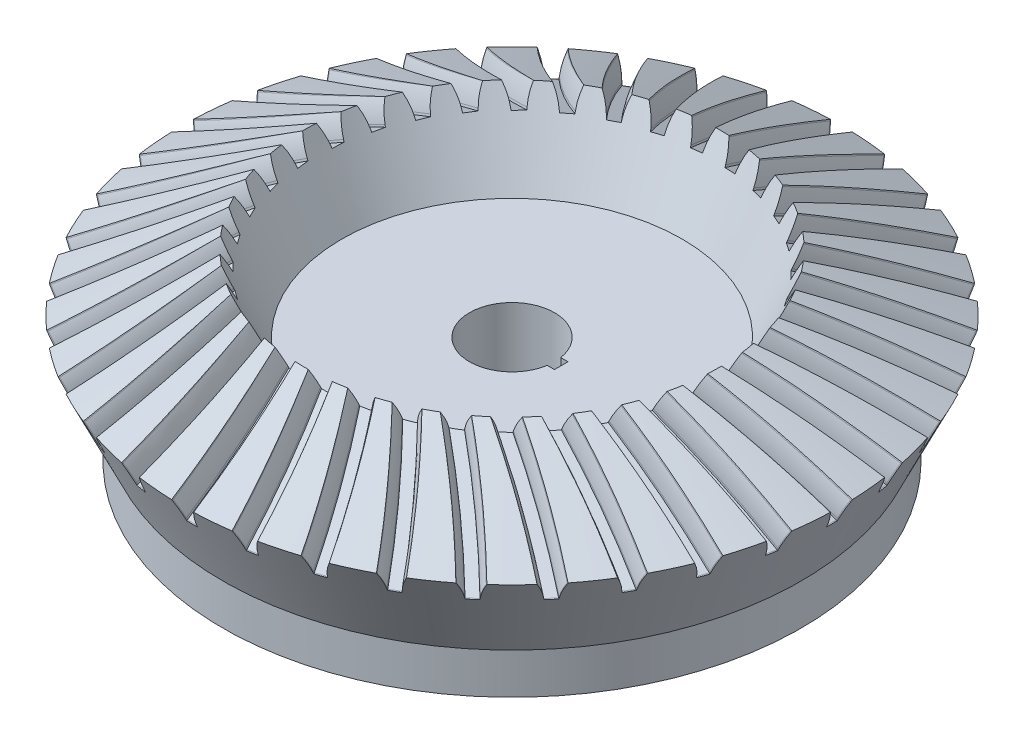
from build123d import *

# Parameters (mm, degrees)
MATRIZC4_COUNT        = 36
CORTAR_EXTRUIR4_DEPTH = 150


with BuildPart() as part:
    # Croquis1 → Revolución1 (revolve)
    with BuildSketch(Plane.XY, mode=Mode.PRIVATE) as revoluci_n1_sk:
        Polygon((0, 0), (0, 40), (50, 40), (60.710750941, 62.589373924), (96.853749219, 45.452172419), (85, 20.452172419), (85, 8.452172419), (20, 8.452172419), (20, 0), align=None)
    revolve(revoluci_n1_sk.sketch.rotate(Axis((0, 0, 0), (0, 1, 0)), 90), axis=Axis((0, 0, 0), (0, 1, 0)))

    # Cortar-Barrer3: sweep along a path in Croquis8
    with BuildLine(Plane(origin=(-35.373111911, 74.603214679, 0), x_dir=(0.9035749569651453, 0.4284300376320922, 0), z_dir=(-0.42843003763209214, 0.9035749569651452, 0))) as cortar_barrer3_path:
        Line((-68.041546343, 0), (-67.759927829, 0.027175505))
        ThreePointArc((-67.759927829, 0.027175505), (-46.725158141, 2.763289123), (-25.917872341, 6.88696602))
        Line((-25.917872341, 6.88696602), (-25.611161062, 6.958391934))
    # Croquis2 → Cortar-Barrer3 (sweep, cut)
    with BuildSketch(Plane(origin=(-61.480637309, -29.15104226, 0), x_dir=(0, 0, 1), z_dir=(-0.9035749569651453, -0.42843003763209214, 0))):
        with BuildLine():
            Line((-1.560552462, 76.001350542), (1.560552462, 76.001350542))
            Line((1.560552462, 76.001350542), (1.624188021, 76.583733508))
            ThreePointArc((1.624188021, 76.583733508), (2.157813142, 79.476228092), (3.109901564, 82.259177666))
            Line((3.109901564, 82.259177666), (3.545588553, 83.280458817))
            Line((3.545588553, 83.280458817), (-3.545588553, 83.280458817))
            Line((-3.545588553, 83.280458817), (-3.109901564, 82.259177666))
            ThreePointArc((-3.109901564, 82.259177666), (-2.157813142, 79.476228092), (-1.624188021, 76.583733508))
            Line((-1.624188021, 76.583733508), (-1.560552462, 76.001350542))
        make_face()
    cortar_barrer3 = sweep(path=cortar_barrer3_path.line, mode=Mode.SUBTRACT)

    # MatrizC4: Cortar-Barrer3 ×36 about axis
    matrizc4_axis = Axis((0, 45.452172419, 0), (0, -1, 0))
    for i in range(1, MATRIZC4_COUNT):
        add(cortar_barrer3.rotate(matrizc4_axis, i * 360 / MATRIZC4_COUNT), mode=Mode.SUBTRACT)

    # Croquis10 → Cortar-Extruir4 (cut)
    with BuildSketch(Plane.XZ):
        with BuildLine():
            Line((12.340923327, -1.987866051), (14.467099583, -1.987866051))
            Line((14.467099583, -1.987866051), (14.467099583, 1.987866051))
            Line((14.467099583, 1.987866051), (12.340923327, 1.987866051))
            ThreePointArc((12.340923327, 1.987866051), (-12.5, 0), (12.340923327, -1.987866051))
        make_face()
    extrude(amount=-CORTAR_EXTRUIR4_DEPTH, mode=Mode.SUBTRACT)


solid = part.part
